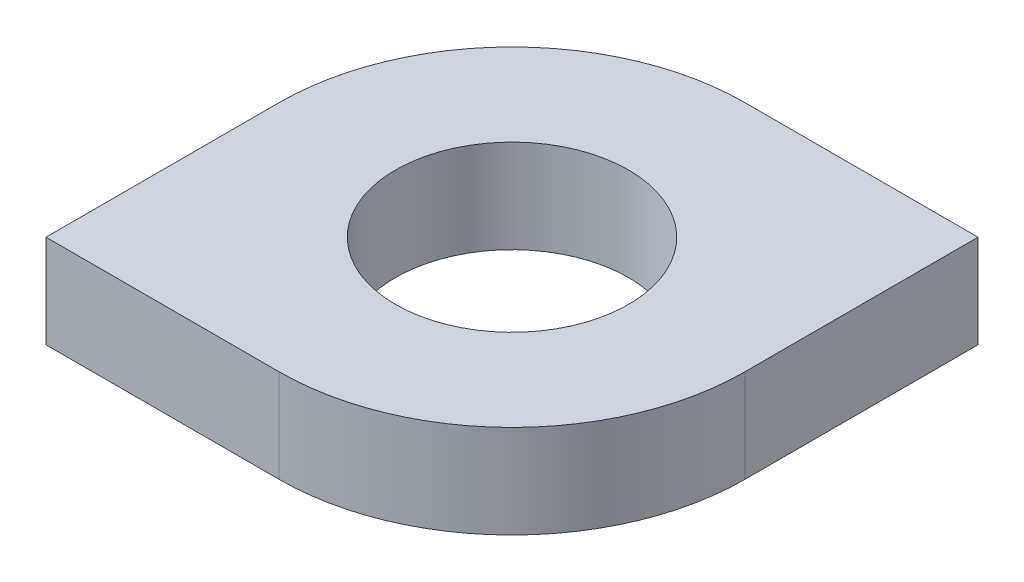
from build123d import *

# Parameters (mm, degrees)
EXTRUDE_1_DEPTH     = 4
SKETCH_2_R          = 5
CUT_EXTRUDE_1_DEPTH = 29.565713714


with BuildPart() as part:
    # Эскиз1 → Бобышка-Вытянуть1 (new body)
    with BuildSketch(Plane(origin=(0, 0, 0), x_dir=(1, 0, 0), z_dir=(0, 1, 0))):
        with BuildLine():
            Line((0, 0), (10, 0))
            ThreePointArc((10, 0), (17.071067812, 2.928932188), (20, 10))
            Line((20, 10), (20, 20))
            Line((20, 20), (10, 20))
            ThreePointArc((10, 20), (2.928932188, 17.071067812), (0, 10))
            Line((0, 10), (0, 0))
        make_face()
    extrude(amount=EXTRUDE_1_DEPTH)

    # Эскиз2 → Вырез-Вытянуть1 (cut, through all)
    with BuildSketch(Plane(origin=(0, 4, 0), x_dir=(1, 0, 0), z_dir=(0, 1, 0))):
        with Locations((10, 10)):
            Circle(SKETCH_2_R)
    extrude(amount=-CUT_EXTRUDE_1_DEPTH, mode=Mode.SUBTRACT)


solid = part.part
